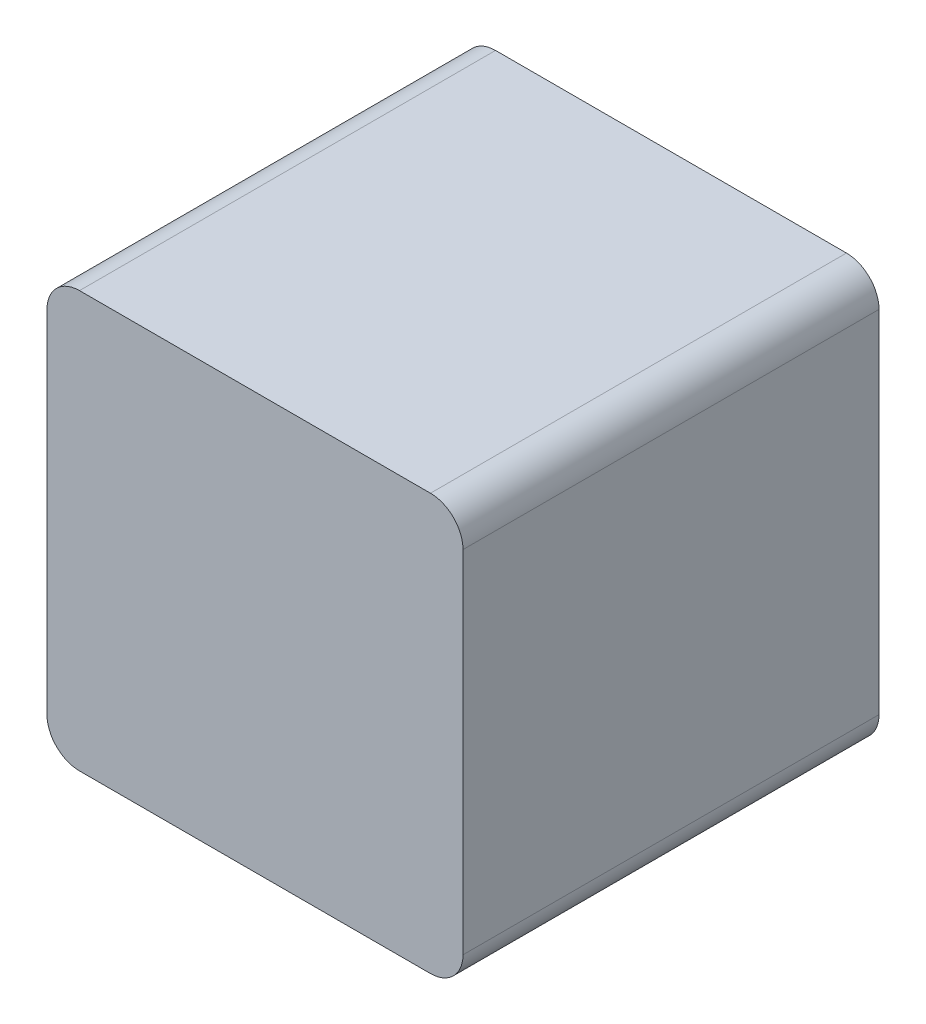
from build123d import *

# Parameters (mm, degrees)
BOSS_EXTRUDE1_DEPTH = 50


with BuildPart() as part:
    # Sketch1 → Boss-Extrude1 (new body)
    with BuildSketch(Plane.XY):
        with BuildLine():
            ThreePointArc((-25, -21.09), (-23.854787514, -23.854787514), (-21.09, -25))
            Line((-21.09, -25), (21.09, -25))
            ThreePointArc((21.09, -25), (23.854787514, -23.854787514), (25, -21.09))
            Line((25, -21.09), (25, 21.09))
            ThreePointArc((25, 21.09), (23.854787514, 23.854787514), (21.09, 25))
            Line((21.09, 25), (-21.09, 25))
            ThreePointArc((-21.09, 25), (-23.854787514, 23.854787514), (-25, 21.09))
            Line((-25, 21.09), (-25, -21.09))
        make_face()
    extrude(amount=BOSS_EXTRUDE1_DEPTH)


solid = part.part
